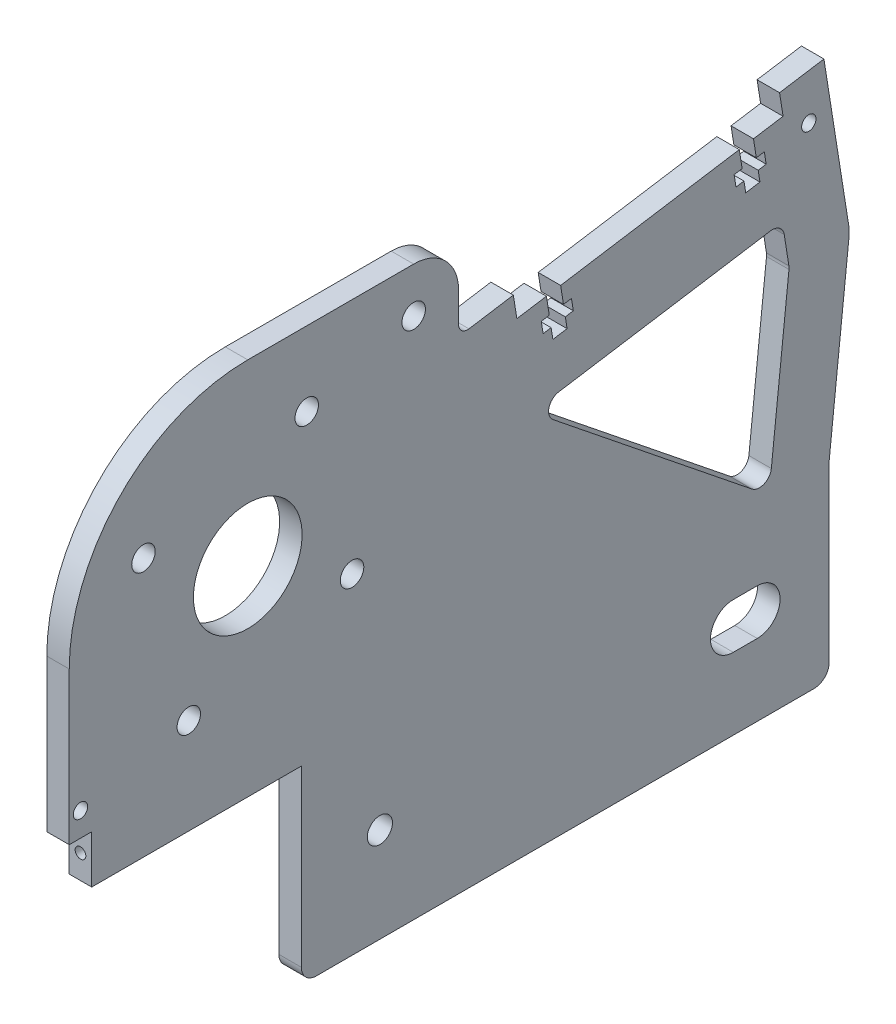
from build123d import *

# Parameters (mm, degrees)
SKETCH1_R           = 2.4892
SKETCH1_R_2         = 2.667
SKETCH1_R_3         = 1.524
SKETCH1_R_4         = 11.522750336
BOSS_EXTRUDE1_DEPTH = 4.7625
SKETCH2_R           = 1.1303
CUT_EXTRUDE1_DEPTH  = 6.35


with BuildPart() as part:
    # Sketch1 → Boss-Extrude1 (new body)
    with BuildSketch(Plane(origin=(0, 0, 0), x_dir=(0, 0, -1), z_dir=(1, 0, 0))):
        with BuildLine():
            Line((-28.170295117, 0), (77.382795117, 0))
            ThreePointArc((77.382795117, 0), (79.627859148, 0.92993597), (80.557795117, 3.175))
            Line((80.557795117, 3.175), (80.557795117, 40.132))
            Line((80.557795117, 40.132), (84.771740045, 79.196103092))
            ThreePointArc((84.771740045, 79.196103092), (84.816236398, 80.272287311), (84.718413682, 81.344939685))
            Line((84.718413682, 81.344939685), (79.457064092, 114.563793628))
            Line((79.457064092, 114.563793628), (70.049332648, 113.073755348))
            Line((70.049332648, 113.073755348), (70.794351787, 108.369889626))
            Line((70.794351787, 108.369889626), (64.522530825, 107.376530773))
            Line((64.522530825, 107.376530773), (65.123512931, 103.582079091))
            Line((65.123512931, 103.582079091), (66.816904591, 103.850285981))
            Line((66.816904591, 103.850285981), (67.209281338, 101.372916701))
            Line((67.209281338, 101.372916701), (65.515889678, 101.10470981))
            Line((65.515889678, 101.10470981), (65.888399247, 98.752776949))
            Line((65.888399247, 98.752776949), (62.877925185, 98.2759647))
            Line((62.877925185, 98.2759647), (62.505415615, 100.627897561))
            Line((62.505415615, 100.627897561), (60.812023956, 100.359690671))
            Line((60.812023956, 100.359690671), (60.419647209, 102.837059951))
            Line((60.419647209, 102.837059951), (62.113038869, 103.105266841))
            Line((62.113038869, 103.105266841), (61.512056762, 106.899718524))
            Line((61.512056762, 106.899718524), (23.630258147, 100.899831052))
            Line((23.630258147, 100.899831052), (24.231240253, 97.105379369))
            Line((24.231240253, 97.105379369), (25.924631913, 97.373586259))
            Line((25.924631913, 97.373586259), (26.31700866, 94.896216979))
            Line((26.31700866, 94.896216979), (24.623617, 94.628010089))
            Line((24.623617, 94.628010089), (24.99612657, 92.276077228))
            Line((24.99612657, 92.276077228), (21.985652508, 91.799264978))
            Line((21.985652508, 91.799264978), (21.613142938, 94.151197839))
            Line((21.613142938, 94.151197839), (19.919751278, 93.882990949))
            Line((19.919751278, 93.882990949), (19.527374531, 96.360360229))
            Line((19.527374531, 96.360360229), (21.220766191, 96.62856712))
            Line((21.220766191, 96.62856712), (20.619784085, 100.423018802))
            Line((20.619784085, 100.423018802), (14.347963122, 99.429659949))
            Line((14.347963122, 99.429659949), (13.602943983, 104.133525671))
            Line((13.602943983, 104.133525671), (4.195212538, 102.643487392))
            ThreePointArc((4.195212538, 102.643487392), (2.66000635, 103.076460316), (1.992204883, 104.52503368))
            Line((1.992204883, 104.52503368), (1.992204883, 110.875))
            ThreePointArc((1.992204883, 110.875), (-0.797603027, 117.610192091), (-7.532795117, 120.4))
            Line((-7.532795117, 120.4), (-42.707795117, 120.4))
            ThreePointArc((-42.707795117, 120.4), (-69.471786785, 109.313991668), (-80.557795117, 82.55))
            Line((-80.557795117, 82.55), (-80.557795117, 50.292))
            Line((-80.557795117, 50.292), (-75.795295117, 50.292))
            Line((-75.795295117, 50.292), (-75.795295117, 40.132))
            Line((-75.795295117, 40.132), (-31.345295117, 40.132))
            Line((-31.345295117, 40.132), (-31.345295117, 3.175))
            ThreePointArc((-31.345295117, 3.175), (-30.415359148, 0.92993597), (-28.170295117, 0))
        make_face()
        with Locations((-55.209041359, 60.43939525)):
            Circle(SKETCH1_R, mode=Mode.SUBTRACT)
        with Locations((-14.692204883, 20.066)):
            Circle(SKETCH1_R_2, mode=Mode.SUBTRACT)
        with Locations((-20.597190367, 70.048753759)):
            Circle(SKETCH1_R, mode=Mode.SUBTRACT)
        with Locations((-64.818399868, 95.051246241)):
            Circle(SKETCH1_R, mode=Mode.SUBTRACT)
        with Locations((-30.206548876, 104.66060475)):
            Circle(SKETCH1_R, mode=Mode.SUBTRACT)
        with Locations((-78.176545117, 55.372)):
            Circle(SKETCH1_R_3, mode=Mode.SUBTRACT)
        with Locations((-42.707795117, 82.55)):
            Circle(SKETCH1_R_4, mode=Mode.SUBTRACT)
        with Locations((-7.532795117, 110.875)):
            Circle(SKETCH1_R, mode=Mode.SUBTRACT)
        with Locations((76.243236649, 104.411043044)):
            Circle(SKETCH1_R_3, mode=Mode.SUBTRACT)
        with BuildLine():
            Line((65.317795117, 15.2273), (60.237795117, 15.2273))
            ThreePointArc((60.237795117, 15.2273), (55.399095117, 20.066), (60.237795117, 24.9047))
            Line((60.237795117, 24.9047), (65.317795117, 24.9047))
            ThreePointArc((65.317795117, 24.9047), (70.156495117, 20.066), (65.317795117, 15.2273))
        make_face(mode=Mode.SUBTRACT)
        with BuildLine():
            Line((71.035861406, 86.549018926), (72.027193342, 80.289995416))
            ThreePointArc((72.027193342, 80.289995416), (72.057683184, 79.9556661), (72.043814352, 79.620235963))
            Line((72.043814352, 79.620235963), (68.302723543, 44.939584088))
            ThreePointArc((68.302723543, 44.939584088), (66.751491112, 42.866217372), (64.187855338, 43.230831164))
            Line((64.187855338, 43.230831164), (22.026684653, 77.057314107))
            ThreePointArc((22.026684653, 77.057314107), (21.161269703, 79.690326664), (23.218859921, 81.547211328))
            Line((23.218859921, 81.547211328), (68.12978948, 88.66040377))
            ThreePointArc((68.12978948, 88.66040377), (70.020107562, 88.206578551), (71.035861406, 86.549018926))
        make_face(mode=Mode.SUBTRACT)
    extrude(amount=BOSS_EXTRUDE1_DEPTH)

    # Sketch2 → Cut-Extrude1 (cut)
    with BuildSketch(Plane.XY.offset(75.795295117)):
        with Locations((2.38125, 45.212)):
            Circle(SKETCH2_R)
    extrude(amount=-CUT_EXTRUDE1_DEPTH, mode=Mode.SUBTRACT)


solid = part.part
